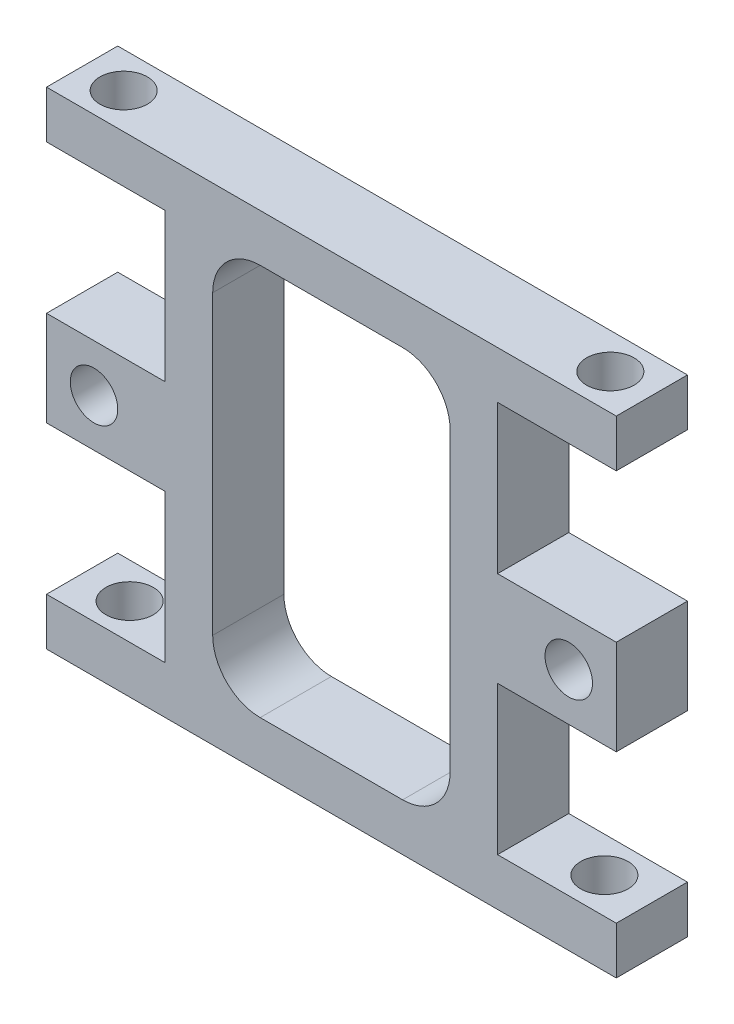
from build123d import *

# Parameters (mm, degrees)
SKETCH2_R           = 3.175
SKETCH2_W           = 31.75
SKETCH2_H           = 52.3875
BOSS_EXTRUDE1_DEPTH = 9.525
FILLET1_R           = 6.35
CUT_EXTRUDE1_REACH  = 78.018
SKETCH3_R           = 3.175
CUT_EXTRUDE2_REACH  = 78.018
SKETCH4_R           = 3.175


with BuildPart() as part:
    # Sketch2 → Boss-Extrude1 (new body)
    with BuildSketch(Plane.XY):
        Polygon((-22.225, -26.19375), (-22.225, -6.35), (-38.1, -6.35), (-38.1, 6.35), (-22.225, 6.35), (-22.225, 26.19375), (-38.1, 26.19375), (-38.1, 32.54375), (38.1, 32.54375), (38.1, 26.19375), (22.225, 26.19375), (22.225, 6.35), (38.1, 6.35), (38.1, -6.35), (22.225, -6.35), (22.225, -26.19375), (38.1, -26.19375), (38.1, -32.54375), (-38.1, -32.54375), (-38.1, -26.19375), align=None)
        with Locations((-31.75, 0)):
            Circle(SKETCH2_R, mode=Mode.SUBTRACT)
        with Locations((31.75, 0)):
            Circle(SKETCH2_R, mode=Mode.SUBTRACT)
        Rectangle(SKETCH2_W, SKETCH2_H, mode=Mode.SUBTRACT)
    extrude(amount=BOSS_EXTRUDE1_DEPTH)

    # Fillet1
    fillet1_edges = [part.edges().sort_by_distance(p)[0] for p in [
        (15.875, 26.19375, 4.7625),
        (-15.875, 26.19375, 4.7625),
        (15.875, -26.19375, 4.7625),
        (-15.875, -26.19375, 4.7625),
    ]]
    fillet(fillet1_edges, radius=FILLET1_R)

    # Sketch3 → Cut-Extrude1 (cut, up to next)
    with BuildSketch(Plane(origin=(0, 32.54375, 0), x_dir=(1, 0, 0), z_dir=(0, 1, 0)), mode=Mode.PRIVATE) as cut_extrude1_sk1:
        with Locations((-32.54375, -4.7625)):
            Circle(SKETCH3_R)
    cut_extrude1_tool1 = extrude(cut_extrude1_sk1.sketch, amount=-CUT_EXTRUDE1_REACH, mode=Mode.PRIVATE) & part.part
    # Sketch3 → Cut-Extrude1 (cut, up to next)
    with BuildSketch(Plane(origin=(0, 32.54375, 0), x_dir=(1, 0, 0), z_dir=(0, 1, 0)), mode=Mode.PRIVATE) as cut_extrude1_sk2:
        with Locations((32.54375, -4.7625)):
            Circle(SKETCH3_R)
    cut_extrude1_tool2 = extrude(cut_extrude1_sk2.sketch, amount=-CUT_EXTRUDE1_REACH, mode=Mode.PRIVATE) & part.part
    add(cut_extrude1_tool1.solids().sort_by_distance((-32.54375, 32.54375, 4.7625))[0], mode=Mode.SUBTRACT)
    add(cut_extrude1_tool2.solids().sort_by_distance((32.54375, 32.54375, 4.7625))[0], mode=Mode.SUBTRACT)

    # Sketch4 → Cut-Extrude2 (cut, up to next)
    with BuildSketch(Plane.XZ.offset(32.54375), mode=Mode.PRIVATE) as cut_extrude2_sk1:
        with Locations((-31.75, 4.7625)):
            Circle(SKETCH4_R)
    cut_extrude2_tool1 = extrude(cut_extrude2_sk1.sketch, amount=-CUT_EXTRUDE2_REACH, mode=Mode.PRIVATE) & part.part
    # Sketch4 → Cut-Extrude2 (cut, up to next)
    with BuildSketch(Plane.XZ.offset(32.54375), mode=Mode.PRIVATE) as cut_extrude2_sk2:
        with Locations((31.75, 4.7625)):
            Circle(SKETCH4_R)
    cut_extrude2_tool2 = extrude(cut_extrude2_sk2.sketch, amount=-CUT_EXTRUDE2_REACH, mode=Mode.PRIVATE) & part.part
    add(cut_extrude2_tool1.solids().sort_by_distance((-31.75, -32.54375, 4.7625))[0], mode=Mode.SUBTRACT)
    add(cut_extrude2_tool2.solids().sort_by_distance((31.75, -32.54375, 4.7625))[0], mode=Mode.SUBTRACT)


solid = part.part
